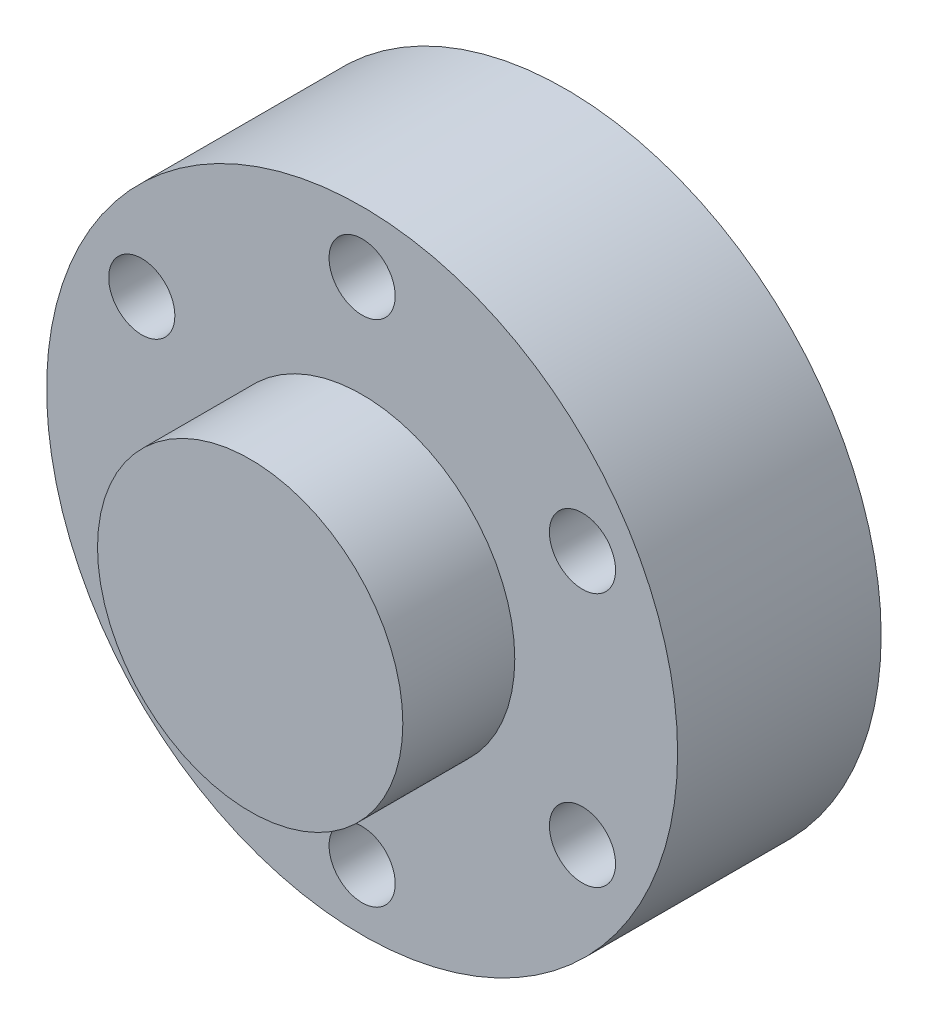
from build123d import *

# Parameters (mm, degrees)
SKETCH2_R           = 15.5
SKETCH2_R_2         = 1.625
BOSS_EXTRUDE1_DEPTH = 10
SKETCH3_R           = 7.5
BOSS_EXTRUDE2_DEPTH = 5.5
BOSS_EXTRUDE4_START = 5.5
SKETCH6_R           = 7.5
BOSS_EXTRUDE4_DEPTH = 5.5
SKETCH7_R           = 2
BOSS_EXTRUDE5_DEPTH = 1
FILLET2_R           = 0.05
CUT_EXTRUDE1_DEPTH  = 11


with BuildPart() as part:
    # Sketch2 → Boss-Extrude1 (new body)
    with BuildSketch(Plane.XY):
        Circle(SKETCH2_R)
        with Locations((0, -12.5)):
            Circle(SKETCH2_R_2, mode=Mode.SUBTRACT)
        with Locations((-10.825317547, -6.25)):
            Circle(SKETCH2_R_2, mode=Mode.SUBTRACT)
        with Locations((10.825317547, -6.25)):
            Circle(SKETCH2_R_2, mode=Mode.SUBTRACT)
        with Locations((-10.825317547, 6.25)):
            Circle(SKETCH2_R_2, mode=Mode.SUBTRACT)
        with Locations((0, 12.5)):
            Circle(SKETCH2_R_2, mode=Mode.SUBTRACT)
        with Locations((10.825317547, 6.25)):
            Circle(SKETCH2_R_2, mode=Mode.SUBTRACT)
    extrude(amount=BOSS_EXTRUDE1_DEPTH)

    # Sketch3 → Boss-Extrude2 (add)
    with BuildSketch(Plane.XY.offset(10)):
        Circle(SKETCH3_R)
    extrude(amount=BOSS_EXTRUDE2_DEPTH)

    # Sketch6 → Boss-Extrude4 (add)
    with BuildSketch(Plane(origin=(0, 0, 0), x_dir=(-1, 0, 0), z_dir=(0, 0, -1)).offset(BOSS_EXTRUDE4_START)):
        Circle(SKETCH6_R)
    extrude(amount=-BOSS_EXTRUDE4_DEPTH)

    # Sketch7 → Boss-Extrude5 (add)
    with BuildSketch(Plane(origin=(0, 0, -5.5), x_dir=(-1, 0, 0), z_dir=(0, 0, -1))):
        Circle(SKETCH7_R)
    extrude(amount=BOSS_EXTRUDE5_DEPTH)

    # Fillet2
    fillet2_edges = [part.edges().sort_by_distance(p)[0] for p in [
        (2, 0, -6.5),
    ]]
    fillet(fillet2_edges, radius=FILLET2_R)

    # Sketch9 → Cut-Extrude1 (cut)
    with BuildSketch(Plane(origin=(0, 0, -6.5), x_dir=(-1, 0, 0), z_dir=(0, 0, -1))):
        with BuildLine():
            Line((-1.224744871, 1.25), (1.224744871, 1.25))
            ThreePointArc((1.224744871, 1.25), (0, -1.75), (-1.224744871, 1.25))
        make_face()
    extrude(amount=-CUT_EXTRUDE1_DEPTH, mode=Mode.SUBTRACT)


solid = part.part
